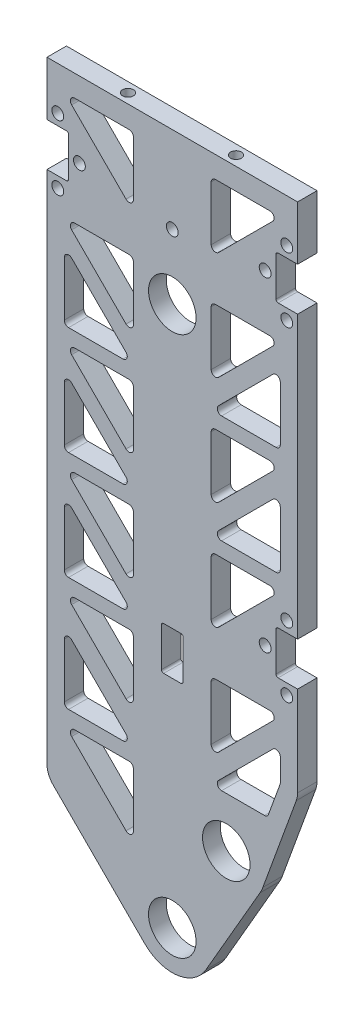
from build123d import *
from build123d.topology import SkipClean

# Parameters (mm, degrees)
SKETCH_1_R                   = 11
EXTRUDE_569_DEPTH            = 100
EXTRUDE_START                = -100
SKETCH_2_R                   = 11
EXTRUDE_878_DEPTH            = 100
EXTRUDE_2694_DEPTH           = 100
CUT_EXTRUDE_4151_DEPTH       = 534.010318849
CUT_EXTRUDE_4151_DEPTH_BACK  = 534.010318849
SKETCH_3_W                   = 90
SKETCH_3_H                   = 380
SKETCH_5_R                   = 2.5
EXTRUDE_4717_DEPTH           = 100
SKETCH_6_W                   = 191.177045066
SKETCH_6_H                   = 235.084722287
CUT_EXTRUDE_5031_DEPTH       = 84
SKETCH_7_R                   = 75
EXTRUDE_5319_DEPTH           = 5
CUT_EXTRUDE_6101_DEPTH       = 357.195171219
CUT_EXTRUDE_6101_DEPTH_BACK  = 357.195171219
FILLET_2_R                   = 2
MIRROR_START                 = 95
MIRROR_1_DEPTH               = 5
CUT_EXTRUDE_11154_DEPTH      = 357.195171219
CUT_EXTRUDE_11154_DEPTH_BACK = 357.195171219
SKETCH_12_W                  = 10
SKETCH_12_H                  = 20
FILLET_3_R                   = 1
CUT_EXTRUDE_START            = -5
CUT_EXTRUDE_12035_OUTLINE_R  = 5
CUT_EXTRUDE_12035_DEPTH      = 5
CUT_EXTRUDE_7_DEPTH          = 357.195171219
CUT_EXTRUDE_7_DEPTH_BACK     = 357.195171219
SKETCH_14_W                  = 10
SKETCH_14_H                  = 20
FILLET_4_R                   = 1
CUT_EXTRUDE_START_2          = -129
SKETCH_15_R                  = 11
CUT_EXTRUDE_8_DEPTH          = 129
SKETCH_16_R                  = 13
CUT_EXTRUDE_9_DEPTH          = 0.75
CUT_EXTRUDE_START_3          = -0.75
SKETCH_17_R                  = 13
CUT_EXTRUDE_10_DEPTH         = 0.75
SKETCH_18_R                  = 11
CUT_EXTRUDE_11_DEPTH         = 113
CUT_EXTRUDE_12_DEPTH         = 357.195171219
CUT_EXTRUDE_12_DEPTH_BACK    = 357.195171219
MOVE_FACE_1_BY               = 4
SKETCH_21_R                  = 2.5
CUT_EXTRUDE_13_DEPTH         = 22
SKETCH_22_R                  = 2.75
CUT_EXTRUDE_14_DEPTH         = 22
CUT_EXTRUDE_15_DEPTH         = 326.338285481
CUT_EXTRUDE_15_DEPTH_BACK    = 326.338285481
SKETCH_23_R                  = 2.75
SKETCH_24_R                  = 13
CUT_EXTRUDE_16_DEPTH         = 0.75
FILLET_5_R                   = 10


# Read off the part's stored shape, not the designer's step: 镜向1, 电机安装轴承孔
with BuildPart() as part:
    # 草图1 → Extrude 569 (new body)
    with BuildSketch(Plane.XY):
        with BuildLine():
            Line((-18, 500), (-18, 0))
            ThreePointArc((-18, 0), (0, -18), (18, 0))
            Line((18, 0), (18, 500))
            ThreePointArc((18, 500), (0, 518), (-18, 500))
        make_face()
        with Locations((0, 500)):
            Circle(SKETCH_1_R, mode=Mode.SUBTRACT)
        Circle(SKETCH_1_R, mode=Mode.SUBTRACT)
    extrude(amount=EXTRUDE_569_DEPTH)

    # 草图2 → Extrude 878 (add)
    with BuildSketch(Plane.XY.offset(100).offset(EXTRUDE_START)):
        with BuildLine():
            Line((18, 61.301270189), (25, 61.301270189))
            ThreePointArc((25, 61.301270189), (40.588457268, 52.301270189), (40.588457268, 34.301270189))
            Line((40.588457268, 34.301270189), (15.588457268, -9))
            ThreePointArc((15.588457268, -9), (-4.658742812, -17.386664873), (-18, 0))
            Line((-18, 0), (-18, 61.301270189))
            Line((-18, 61.301270189), (18, 61.301270189))
        make_face()
        with Locations((25, 43.301270189)):
            Circle(SKETCH_2_R, mode=Mode.SUBTRACT)
        Circle(SKETCH_2_R, mode=Mode.SUBTRACT)
    extrude(amount=EXTRUDE_878_DEPTH)

    # 草图10 → Extrude 2694 (add)
    with BuildSketch(Plane(origin=(0, 0, 0), x_dir=(-1, 0, 0), z_dir=(0, 0, -1))):
        with BuildLine():
            Line((-41.914467174, 37.144907609), (-58, 81.339545828))
            Line((-58, 81.339545828), (-58, 320))
            Line((-58, 320), (-18, 320))
            Line((-18, 320), (-18, 61.301270189))
            Line((-18, 61.301270189), (-25, 61.301270189))
            ThreePointArc((-25, 61.301270189), (-39.744736797, 53.625646044), (-41.914467174, 37.144907609))
        make_face()
        with BuildLine():
            Line((12.727922061, -12.727922061), (58, 32.544155877))
            Line((58, 32.544155877), (58, 320))
            Line((58, 320), (18, 320))
            Line((18, 320), (18, 0))
            ThreePointArc((18, 0), (16.629831585, -6.888301783), (12.727922061, -12.727922061))
        make_face()
    extrude(amount=-EXTRUDE_2694_DEPTH)

    # 草图3 → Cut-Extrude 4151 (cut, two sides: drawn at the far end of the back side and taken through both)
    with BuildSketch(Plane.ZY.offset(18).offset(-CUT_EXTRUDE_4151_DEPTH_BACK)):
        with Locations((50, 150)):
            Rectangle(SKETCH_3_W, SKETCH_3_H)
    extrude(amount=CUT_EXTRUDE_4151_DEPTH + CUT_EXTRUDE_4151_DEPTH_BACK, mode=Mode.SUBTRACT)

    # 草图5 → Extrude 4717 (add)
    with BuildSketch(Plane.XY.offset(100)):
        with Locations(Location((0, 250, 0), (0, 0, 90))):
            Circle(SKETCH_5_R)
    extrude(amount=-EXTRUDE_4717_DEPTH)

    # 草图6 → Cut-Extrude 5031 (cut)
    with BuildSketch(Plane(origin=(18, 0, 0), x_dir=(0, 0, -1), z_dir=(1, 0, 0))):
        with Locations((-50.962374235, 437.542361144)):
            Rectangle(SKETCH_6_W, SKETCH_6_H)
    extrude(amount=-CUT_EXTRUDE_5031_DEPTH, mode=Mode.SUBTRACT)

    # 草图7 → Extrude 5319 (add)
    with BuildSketch(Plane(origin=(0, 320, 0), x_dir=(1, 0, 0), z_dir=(0, 1, 0))):
        with Locations(Location((0, -50, 0), (0, 0, 320.654170234))):
            Circle(SKETCH_7_R)
    extrude(amount=EXTRUDE_5319_DEPTH)

    # 草图10<3> → Cut-Extrude 6101 (cut, two sides: drawn at the far end of the back side and taken through both)
    with BuildSketch(Plane(origin=(0, 0, 0), x_dir=(-1, 0, 0), z_dir=(0, 0, -1)).offset(-CUT_EXTRUDE_6101_DEPTH_BACK)):
        Polygon((50, 310), (18, 310), (18, 278), align=None)
        Polygon((-18, 278), (-18, 310), (-50, 310), align=None)
        Polygon((-18, 227.925713543), (-18, 259.925713543), (-50, 259.925713543), align=None)
        Polygon((50, 259.925713543), (18, 259.925713543), (18, 227.925713543), align=None)
        Polygon((50, 248.612005044), (50, 216.612005044), (18, 216.612005044), align=None)
        Polygon((-50, 248.612005044), (-50, 216.612005044), (-18, 216.612005044), align=None)
        Polygon((-18, 177.851427085), (-18, 209.851427085), (-50, 209.851427085), align=None)
        Polygon((50, 209.851427085), (18, 209.851427085), (18, 177.851427085), align=None)
        Polygon((50, 198.537718586), (50, 166.537718586), (18, 166.537718586), align=None)
        Polygon((-50, 198.537718586), (-50, 166.537718586), (-18, 166.537718586), align=None)
        Polygon((-50, 159.777140628), (-18, 127.777140628), (-18, 159.777140628), align=None)
        Polygon((18, 159.777140628), (18, 127.777140628), (50, 159.777140628), align=None)
        Polygon((-50, 109.702854171), (-18, 77.702854171), (-18, 109.702854171), align=None)
        Polygon((18, 109.702854171), (18, 77.702854171), (50, 109.702854171), align=None)
        Polygon((-50, 98.389145672), (-50, 82.750161674), (-44.045077173, 66.389145672), (-18, 66.389145672), align=None)
        Polygon((18, 56.800140588), (18, 24.800140588), (50, 56.800140588), align=None)
        Polygon((50, 95.560718547), (50, 63.560718547), (18, 63.560718547), align=None)
        Polygon((50, 116.463432129), (18, 116.463432129), (50, 148.463432129), align=None)
    extrude(amount=CUT_EXTRUDE_6101_DEPTH + CUT_EXTRUDE_6101_DEPTH_BACK, mode=Mode.SUBTRACT)

    # 圆角2
    fillet_2_edges = [part.edges().sort_by_distance(p)[0] for p in [
        (50, 109.702854171, 2.5),
        (18, 109.702854171, 2.5),
        (18, 77.702854171, 2.5),
        (-18, 159.777140628, 2.5),
        (-50, 159.777140628, 2.5),
        (-18, 127.777140628, 2.5),
        (50, 159.777140628, 2.5),
        (18, 159.777140628, 2.5),
        (18, 127.777140628, 2.5),
        (50, 166.537718586, 2.5),
        (50, 198.537718586, 2.5),
        (18, 166.537718586, 2.5),
        (-50, 63.560718547, 2.5),
        (-18, 63.560718547, 2.5),
        (-50, 95.560718547, 2.5),
        (-50, 56.800140588, 2.5),
        (-18, 24.800140588, 2.5),
        (-18, 56.800140588, 2.5),
        (50, 82.750161674, 2.5),
        (50, 98.389145672, 2.5),
        (18, 66.389145672, 2.5),
        (44.045077173, 66.389145672, 2.5),
        (-18, 109.702854171, 2.5),
        (-50, 109.702854171, 2.5),
        (-18, 77.702854171, 2.5),
        (50, 310, 2.5),
        (18, 310, 2.5),
        (18, 278, 2.5),
        (50, 259.925713543, 2.5),
        (18, 259.925713543, 2.5),
        (18, 227.925713543, 2.5),
        (-50, 248.612005044, 2.5),
        (-50, 216.612005044, 2.5),
        (-18, 216.612005044, 2.5),
        (-18, 259.925713543, 2.5),
        (-50, 259.925713543, 2.5),
        (-18, 227.925713543, 2.5),
        (50, 216.612005044, 2.5),
        (50, 248.612005044, 2.5),
        (18, 216.612005044, 2.5),
        (50, 209.851427085, 2.5),
        (18, 209.851427085, 2.5),
        (18, 177.851427085, 2.5),
        (-50, 198.537718586, 2.5),
        (-50, 166.537718586, 2.5),
        (-18, 166.537718586, 2.5),
        (-18, 209.851427085, 2.5),
        (-50, 209.851427085, 2.5),
        (-18, 177.851427085, 2.5),
        (-50, 148.463432129, 2.5),
        (-50, 116.463432129, 2.5),
        (-18, 116.463432129, 2.5),
        (-18, 310, 2.5),
        (-50, 310, 2.5),
        (-18, 278, 2.5),
    ]]
    fillet(fillet_2_edges, radius=FILLET_2_R)

    # 镜向1 outline → 镜向1 (add)
    with BuildSketch(Plane.XY.offset(MIRROR_START)):
        with BuildLine():
            ThreePointArc((-50, 143.635005004), (-48.765366865, 145.482764069), (-46.585786438, 145.049218567))
            Line((-46.585786438, 145.049218567), (-50, 148.463432129))
            Line((-50, 148.463432129), (-50, 143.635005004))
        make_face()
        with BuildLine():
            Line((-18, 116.463432129), (-21.414213562, 119.877645691))
            ThreePointArc((-21.414213562, 119.877645691), (-20.98066806, 117.698065264), (-22.828427125, 116.463432129))
            Line((-22.828427125, 116.463432129), (-18, 116.463432129))
        make_face()
        with BuildLine():
            ThreePointArc((-48, 116.463432129), (-49.414213562, 117.049218567), (-50, 118.463432129))
            Line((-50, 118.463432129), (-50, 116.463432129))
            Line((-50, 116.463432129), (-48, 116.463432129))
        make_face()
        with BuildLine():
            ThreePointArc((-20, 310), (-18.585786438, 309.414213562), (-18, 308))
            Line((-18, 308), (-18, 310))
            Line((-18, 310), (-20, 310))
        make_face()
        with BuildLine():
            Line((-18, 278), (-18, 282.828427125))
            ThreePointArc((-18, 282.828427125), (-19.234633135, 280.98066806), (-21.414213562, 281.414213562))
            Line((-21.414213562, 281.414213562), (-18, 278))
        make_face()
        with BuildLine():
            ThreePointArc((-46.585786438, 306.585786438), (-47.01933194, 308.765366865), (-45.171572875, 310))
            Line((-45.171572875, 310), (-50, 310))
            Line((-50, 310), (-46.585786438, 306.585786438))
        make_face()
        with BuildLine():
            ThreePointArc((-20, 259.925713543), (-18.585786438, 259.339927105), (-18, 257.925713543))
            Line((-18, 257.925713543), (-18, 259.925713543))
            Line((-18, 259.925713543), (-20, 259.925713543))
        make_face()
        with BuildLine():
            Line((-18, 227.925713543), (-18, 232.754140667))
            ThreePointArc((-18, 232.754140667), (-19.234633135, 230.906381602), (-21.414213562, 231.339927105))
            Line((-21.414213562, 231.339927105), (-18, 227.925713543))
        make_face()
        with BuildLine():
            ThreePointArc((-46.585786438, 256.51149998), (-47.01933194, 258.691080407), (-45.171572875, 259.925713543))
            Line((-45.171572875, 259.925713543), (-50, 259.925713543))
            Line((-50, 259.925713543), (-46.585786438, 256.51149998))
        make_face()
        with BuildLine():
            ThreePointArc((-50, 243.783577919), (-48.765366865, 245.631336984), (-46.585786438, 245.197791481))
            Line((-46.585786438, 245.197791481), (-50, 248.612005044))
            Line((-50, 248.612005044), (-50, 243.783577919))
        make_face()
        with BuildLine():
            Line((-18, 216.612005044), (-21.414213562, 220.026218606))
            ThreePointArc((-21.414213562, 220.026218606), (-20.98066806, 217.846638179), (-22.828427125, 216.612005044))
            Line((-22.828427125, 216.612005044), (-18, 216.612005044))
        make_face()
        with BuildLine():
            ThreePointArc((-48, 216.612005044), (-49.414213563, 217.197791481), (-50, 218.612005044))
            Line((-50, 218.612005044), (-50, 216.612005044))
            Line((-50, 216.612005044), (-48, 216.612005044))
        make_face()
        with BuildLine():
            ThreePointArc((-20, 209.851427085), (-18.585786438, 209.265640647), (-18, 207.851427085))
            Line((-18, 207.851427085), (-18, 209.851427085))
            Line((-18, 209.851427085), (-20, 209.851427085))
        make_face()
        with BuildLine():
            Line((-18, 177.851427085), (-18, 182.67985421))
            ThreePointArc((-18, 182.67985421), (-19.234633135, 180.832095145), (-21.414213562, 181.265640648))
            Line((-21.414213562, 181.265640648), (-18, 177.851427085))
        make_face()
        with BuildLine():
            ThreePointArc((-46.585786438, 206.437213523), (-47.01933194, 208.61679395), (-45.171572875, 209.851427085))
            Line((-45.171572875, 209.851427085), (-50, 209.851427085))
            Line((-50, 209.851427085), (-46.585786438, 206.437213523))
        make_face()
        with BuildLine():
            ThreePointArc((-50, 193.709291462), (-48.765366865, 195.557050527), (-46.585786438, 195.123505024))
            Line((-46.585786438, 195.123505024), (-50, 198.537718586))
            Line((-50, 198.537718586), (-50, 193.709291462))
        make_face()
        with BuildLine():
            Line((-18, 166.537718586), (-21.414213562, 169.951932149))
            ThreePointArc((-21.414213562, 169.951932149), (-20.98066806, 167.772351722), (-22.828427125, 166.537718586))
            Line((-22.828427125, 166.537718586), (-18, 166.537718586))
        make_face()
        with BuildLine():
            ThreePointArc((-48, 166.537718586), (-49.414213562, 167.123505024), (-50, 168.537718586))
            Line((-50, 168.537718586), (-50, 166.537718586))
            Line((-50, 166.537718586), (-48, 166.537718586))
        make_face()
        with BuildLine():
            ThreePointArc((-20, 159.777140628), (-18.585786438, 159.19135419), (-18, 157.777140628))
            Line((-18, 157.777140628), (-18, 159.777140628))
            Line((-18, 159.777140628), (-20, 159.777140628))
        make_face()
        with BuildLine():
            Line((-18, 127.777140628), (-18, 132.605567753))
            ThreePointArc((-18, 132.605567753), (-19.234633135, 130.757808688), (-21.414213562, 131.19135419))
            Line((-21.414213562, 131.19135419), (-18, 127.777140628))
        make_face()
        with BuildLine():
            ThreePointArc((-46.585786438, 156.362927066), (-47.01933194, 158.542507493), (-45.171572875, 159.777140628))
            Line((-45.171572875, 159.777140628), (-50, 159.777140628))
            Line((-50, 159.777140628), (-46.585786438, 156.362927066))
        make_face()
        with BuildLine():
            ThreePointArc((-20, 109.702854171), (-18.585786438, 109.117067733), (-18, 107.702854171))
            Line((-18, 107.702854171), (-18, 109.702854171))
            Line((-18, 109.702854171), (-20, 109.702854171))
        make_face()
        with BuildLine():
            Line((-18, 77.702854171), (-18, 82.531281295))
            ThreePointArc((-18, 82.531281295), (-19.234633135, 80.68352223), (-21.414213562, 81.117067733))
            Line((-21.414213562, 81.117067733), (-18, 77.702854171))
        make_face()
        with BuildLine():
            ThreePointArc((-46.585786438, 106.288640608), (-47.01933194, 108.468221035), (-45.171572875, 109.702854171))
            Line((-45.171572875, 109.702854171), (-50, 109.702854171))
            Line((-50, 109.702854171), (-46.585786438, 106.288640608))
        make_face()
        with BuildLine():
            ThreePointArc((-50, 90.732291422), (-48.765366865, 92.580050487), (-46.585786438, 92.146504984))
            Line((-46.585786438, 92.146504984), (-50, 95.560718547))
            Line((-50, 95.560718547), (-50, 90.732291422))
        make_face()
        with BuildLine():
            Line((-18, 63.560718547), (-21.414213562, 66.974932109))
            ThreePointArc((-21.414213562, 66.974932109), (-20.98066806, 64.795351682), (-22.828427125, 63.560718547))
            Line((-22.828427125, 63.560718547), (-18, 63.560718547))
        make_face()
        with BuildLine():
            ThreePointArc((-48, 63.560718547), (-49.414213562, 64.146504984), (-50, 65.560718547))
            Line((-50, 65.560718547), (-50, 63.560718547))
            Line((-50, 63.560718547), (-48, 63.560718547))
        make_face()
        with BuildLine():
            ThreePointArc((-46.585786438, 53.385927026), (-47.01933194, 55.565507453), (-45.171572875, 56.800140588))
            Line((-45.171572875, 56.800140588), (-50, 56.800140588))
            Line((-50, 56.800140588), (-46.585786438, 53.385927026))
        make_face()
        with BuildLine():
            Line((-18, 56.800140588), (-20, 56.800140588))
            ThreePointArc((-20, 56.800140588), (-18.585786437, 56.214354151), (-18, 54.800140588))
            Line((-18, 54.800140588), (-18, 56.800140588))
        make_face()
        with BuildLine():
            ThreePointArc((-18, 29.628567713), (-19.234633135, 27.780808648), (-21.414213562, 28.214354151))
            Line((-21.414213562, 28.214354151), (-18, 24.800140588))
            Line((-18, 24.800140588), (-18, 29.628567713))
        make_face()
        with BuildLine():
            ThreePointArc((46.585786438, 94.974932109), (48.765366865, 95.408477612), (50, 93.560718547))
            Line((50, 93.560718547), (50, 98.389145672))
            Line((50, 98.389145672), (46.585786438, 94.974932109))
        make_face()
        with BuildLine():
            Line((50, 82.750161674), (50, 83.102815635))
            ThreePointArc((50, 83.102815635), (49.969615506, 82.75551928), (49.879385242, 82.418775349))
            Line((49.879385242, 82.418775349), (50, 82.750161674))
        make_face()
        with BuildLine():
            ThreePointArc((22.828427125, 66.389145672), (20.98066806, 67.623778807), (21.414213562, 69.803359234))
            Line((21.414213562, 69.803359234), (18, 66.389145672))
            Line((18, 66.389145672), (22.828427125, 66.389145672))
        make_face()
        with BuildLine():
            Line((44.045077173, 66.389145672), (44.524047338, 67.705105385))
            ThreePointArc((44.524047338, 67.705105385), (43.791814969, 66.750841583), (42.644662096, 66.389145672))
            Line((42.644662096, 66.389145672), (44.045077173, 66.389145672))
        make_face()
        with BuildLine():
            Line((18, 109.702854171), (18, 107.702854171))
            ThreePointArc((18, 107.702854171), (18.585786438, 109.117067733), (20, 109.702854171))
            Line((20, 109.702854171), (18, 109.702854171))
        make_face()
        with BuildLine():
            ThreePointArc((21.414213562, 81.117067733), (19.234633135, 80.68352223), (18, 82.531281295))
            Line((18, 82.531281295), (18, 77.702854171))
            Line((18, 77.702854171), (21.414213562, 81.117067733))
        make_face()
        with BuildLine():
            Line((50, 109.702854171), (45.171572875, 109.702854171))
            ThreePointArc((45.171572875, 109.702854171), (47.01933194, 108.468221035), (46.585786438, 106.288640608))
            Line((46.585786438, 106.288640608), (50, 109.702854171))
        make_face()
        with BuildLine():
            Line((18, 159.777140628), (18, 157.777140628))
            ThreePointArc((18, 157.777140628), (18.585786438, 159.19135419), (20, 159.777140628))
            Line((20, 159.777140628), (18, 159.777140628))
        make_face()
        with BuildLine():
            ThreePointArc((21.414213562, 131.19135419), (19.234633135, 130.757808688), (18, 132.605567753))
            Line((18, 132.605567753), (18, 127.777140628))
            Line((18, 127.777140628), (21.414213562, 131.19135419))
        make_face()
        with BuildLine():
            Line((50, 159.777140628), (45.171572875, 159.777140628))
            ThreePointArc((45.171572875, 159.777140628), (47.01933194, 158.542507493), (46.585786438, 156.362927066))
            Line((46.585786438, 156.362927066), (50, 159.777140628))
        make_face()
        with BuildLine():
            ThreePointArc((50, 168.537718586), (49.414213562, 167.123505024), (48, 166.537718586))
            Line((48, 166.537718586), (50, 166.537718586))
            Line((50, 166.537718586), (50, 168.537718586))
        make_face()
        with BuildLine():
            Line((18, 166.537718586), (22.828427125, 166.537718586))
            ThreePointArc((22.828427125, 166.537718586), (20.98066806, 167.772351722), (21.414213562, 169.951932149))
            Line((21.414213562, 169.951932149), (18, 166.537718586))
        make_face()
        with BuildLine():
            ThreePointArc((46.585786438, 195.123505024), (48.765366865, 195.557050527), (50, 193.709291462))
            Line((50, 193.709291462), (50, 198.537718586))
            Line((50, 198.537718586), (46.585786438, 195.123505024))
        make_face()
        with BuildLine():
            Line((18, 177.851427085), (21.414213562, 181.265640648))
            ThreePointArc((21.414213562, 181.265640648), (19.234633135, 180.832095145), (18, 182.67985421))
            Line((18, 182.67985421), (18, 177.851427085))
        make_face()
        with BuildLine():
            ThreePointArc((45.171572875, 209.851427085), (47.01933194, 208.61679395), (46.585786438, 206.437213523))
            Line((46.585786438, 206.437213523), (50, 209.851427085))
            Line((50, 209.851427085), (45.171572875, 209.851427085))
        make_face()
        with BuildLine():
            Line((18, 209.851427085), (18, 207.851427085))
            ThreePointArc((18, 207.851427085), (18.585786438, 209.265640647), (20, 209.851427085))
            Line((20, 209.851427085), (18, 209.851427085))
        make_face()
        with BuildLine():
            ThreePointArc((50, 218.612005044), (49.414213563, 217.197791481), (48, 216.612005044))
            Line((48, 216.612005044), (50, 216.612005044))
            Line((50, 216.612005044), (50, 218.612005044))
        make_face()
        with BuildLine():
            Line((18, 216.612005044), (22.828427125, 216.612005044))
            ThreePointArc((22.828427125, 216.612005044), (20.98066806, 217.846638179), (21.414213562, 220.026218606))
            Line((21.414213562, 220.026218606), (18, 216.612005044))
        make_face()
        with BuildLine():
            ThreePointArc((46.585786438, 245.197791481), (48.765366865, 245.631336984), (50, 243.783577919))
            Line((50, 243.783577919), (50, 248.612005044))
            Line((50, 248.612005044), (46.585786438, 245.197791481))
        make_face()
        with BuildLine():
            Line((18, 227.925713543), (21.414213562, 231.339927105))
            ThreePointArc((21.414213562, 231.339927105), (19.234633135, 230.906381602), (18, 232.754140667))
            Line((18, 232.754140667), (18, 227.925713543))
        make_face()
        with BuildLine():
            ThreePointArc((45.171572875, 259.925713543), (47.01933194, 258.691080407), (46.585786438, 256.51149998))
            Line((46.585786438, 256.51149998), (50, 259.925713543))
            Line((50, 259.925713543), (45.171572875, 259.925713543))
        make_face()
        with BuildLine():
            Line((18, 259.925713543), (18, 257.925713543))
            ThreePointArc((18, 257.925713543), (18.585786438, 259.339927105), (20, 259.925713543))
            Line((20, 259.925713543), (18, 259.925713543))
        make_face()
        with BuildLine():
            Line((18, 278), (21.414213562, 281.414213562))
            ThreePointArc((21.414213562, 281.414213562), (19.234633135, 280.98066806), (18, 282.828427125))
            Line((18, 282.828427125), (18, 278))
        make_face()
        with BuildLine():
            ThreePointArc((45.171572875, 310), (47.01933194, 308.765366865), (46.585786438, 306.585786438))
            Line((46.585786438, 306.585786438), (50, 310))
            Line((50, 310), (45.171572875, 310))
        make_face()
        with BuildLine():
            Line((18, 310), (18, 308))
            ThreePointArc((18, 308), (18.585786438, 309.414213562), (20, 310))
            Line((20, 310), (18, 310))
        make_face()
    extrude(amount=MIRROR_1_DEPTH)

    # 草图12 → Cut-Extrude 11154 (cut, two sides: drawn at the far end of the back side and taken through both)
    with BuildSketch(Plane(origin=(0, 0, 0), x_dir=(-1, 0, 0), z_dir=(0, 0, -1)).offset(-CUT_EXTRUDE_11154_DEPTH_BACK)):
        with Locations((-53, 285)):
            Rectangle(SKETCH_12_W, SKETCH_12_H)
        with Locations((-53, 134.702854171)):
            Rectangle(SKETCH_12_W, SKETCH_12_H)
        with Locations((53, 285)):
            Rectangle(SKETCH_12_W, SKETCH_12_H)
    extrude(amount=CUT_EXTRUDE_11154_DEPTH + CUT_EXTRUDE_11154_DEPTH_BACK, mode=Mode.SUBTRACT)

    # 圆角3
    fillet_3_edges = [part.edges().sort_by_distance(p)[0] for p in [
        (-48, 275, 2.5),
        (-48, 295, 2.5),
        (-48, 275, 97.5),
        (-48, 295, 97.5),
        (48, 144.702854171, 2.5),
        (48, 124.702854171, 2.5),
        (48, 144.702854171, 97.5),
        (48, 124.702854171, 97.5),
        (48, 295, 2.5),
        (48, 275, 2.5),
        (48, 295, 97.5),
        (48, 275, 97.5),
    ]]
    fillet(fillet_3_edges, radius=FILLET_3_R)

    # Cut-Extrude 12035 outline → Cut-Extrude 12035 (cut)
    with BuildSketch(Plane.XY.offset(5).offset(CUT_EXTRUDE_START)):
        with Locations((0, 250)):
            Circle(CUT_EXTRUDE_12035_OUTLINE_R)
    cut_extrude_12035 = extrude(amount=CUT_EXTRUDE_12035_DEPTH, mode=Mode.SUBTRACT)

    # 镜向2: Cut-Extrude 12035 across plane
    add(cut_extrude_12035.mirror(Plane(origin=(0, 0, 50), x_dir=(1, 0, 0), z_dir=(0, 0, -1))), mode=Mode.SUBTRACT)

    # 草图14 → 切除-拉伸7 (cut, two sides: drawn at the far end of the back side and taken through both)
    with BuildSketch(Plane(origin=(0, 0, 0), x_dir=(-1, 0, 0), z_dir=(0, 0, -1)).offset(-CUT_EXTRUDE_7_DEPTH_BACK)):
        with Locations((0, 110)):
            Rectangle(SKETCH_14_W, SKETCH_14_H)
    extrude(amount=CUT_EXTRUDE_7_DEPTH + CUT_EXTRUDE_7_DEPTH_BACK, mode=Mode.SUBTRACT)

    # 圆角4
    fillet_4_edges = [part.edges().sort_by_distance(p)[0] for p in [
        (5, 100, 2.5),
        (5, 120, 2.5),
        (-5, 120, 2.5),
        (-5, 100, 2.5),
        (5, 100, 97.5),
        (5, 120, 97.5),
        (-5, 120, 97.5),
        (-5, 100, 97.5),
    ]]
    fillet(fillet_4_edges, radius=FILLET_4_R)

    # 草图15 → 切除-拉伸8 (cut)
    with BuildSketch(Plane.XY.offset(100).offset(CUT_EXTRUDE_START_2)):
        with Locations((25, 43.301270189)):
            Circle(SKETCH_15_R)
    extrude(amount=CUT_EXTRUDE_8_DEPTH, mode=Mode.SUBTRACT)

    # 草图16 → 切除-拉伸9 (cut)
    with BuildSketch(Plane.XY.offset(100)):
        with Locations((25, 43.301270189)):
            Circle(SKETCH_16_R)
        Circle(SKETCH_16_R)
    extrude(amount=-CUT_EXTRUDE_9_DEPTH, mode=Mode.SUBTRACT)

    # 草图17 → 切除-拉伸10 (cut)
    with BuildSketch(Plane(origin=(0, 0, 0), x_dir=(-1, 0, 0), z_dir=(0, 0, -1)).offset(CUT_EXTRUDE_START_3)):
        with Locations(Location((0, 0, 0), (0, 0, 180))):
            Circle(SKETCH_17_R)
        with Locations(Location((-25, 43.301270189, 0), (0, 0, 180))):
            Circle(SKETCH_17_R)
    extrude(amount=CUT_EXTRUDE_10_DEPTH, mode=Mode.SUBTRACT)

    # 草图18 → 切除-拉伸11 (cut)
    with BuildSketch(Plane.XY.offset(100)):
        with Locations((0, 250)):
            Circle(SKETCH_18_R)
    extrude(amount=-CUT_EXTRUDE_11_DEPTH, mode=Mode.SUBTRACT)

    # 草图20 → 切除-拉伸12 (cut, two sides: drawn at the far end of the back side and taken through both)
    with BuildSketch(Plane(origin=(0, 0, 0), x_dir=(0, 0, -1), z_dir=(1, 0, 0)).offset(-CUT_EXTRUDE_12_DEPTH_BACK)):
        Polygon((0, 320), (25, 320), (25, 325), (-125, 325), (-125, -65.067335994), (-50, -65.067335994), (-50, 320), align=None)
    extrude(amount=CUT_EXTRUDE_12_DEPTH + CUT_EXTRUDE_12_DEPTH_BACK, mode=Mode.SUBTRACT)

    # Move Face 1: a face moved outward by 4.0
    extrude(part.faces().sort_by_distance((-0.855426636, 163.028428235, 5))[0], amount=MOVE_FACE_1_BY, dir=(0, 0, 1))

    # 草图21 → 切除-拉伸13 (cut)
    with SkipClean():  # the faces are left unmerged after this step: merging them gives an invalid solid
        with BuildSketch(Plane(origin=(0, 320, 0), x_dir=(1, 0, 0), z_dir=(0, 1, 0))):
            with Locations(Location((25, -4.5, 0), (0, 0, 270))):
                Circle(SKETCH_21_R)
            with Locations(Location((-25, -4.5, 0), (0, 0, 270))):
                Circle(SKETCH_21_R)
        extrude(amount=-CUT_EXTRUDE_13_DEPTH, mode=Mode.SUBTRACT)

    # 草图22 → 切除-拉伸14 (cut)
    with SkipClean():  # the faces are left unmerged after this step: merging them gives an invalid solid
        with BuildSketch(Plane(origin=(0, 0, 0), x_dir=(-1, 0, 0), z_dir=(0, 0, -1))):
            with Locations((0, 280)):
                Circle(SKETCH_22_R)
        extrude(amount=-CUT_EXTRUDE_14_DEPTH, mode=Mode.SUBTRACT)

    # 草图23 → 切除-拉伸15 (cut, two sides: drawn at the far end of the back side and taken through both)
    with SkipClean():  # the faces are left unmerged after this step: merging them gives an invalid solid
        with BuildSketch(Plane(origin=(0, 0, 0), x_dir=(-1, 0, 0), z_dir=(0, 0, -1)).offset(-CUT_EXTRUDE_15_DEPTH_BACK)):
            with Locations((53, 300)):
                Circle(SKETCH_23_R)
            with Locations((43, 285)):
                Circle(SKETCH_23_R)
            with Locations((53, 270)):
                Circle(SKETCH_23_R)
            with Locations((-53, 300)):
                Circle(SKETCH_23_R)
            with Locations((-43, 285)):
                Circle(SKETCH_23_R)
            with Locations((-53, 270)):
                Circle(SKETCH_23_R)
            with Locations((-53, 149.702854171)):
                Circle(SKETCH_23_R)
            with Locations((-43, 134.702854171)):
                Circle(SKETCH_23_R)
            with Locations((-53, 119.702854171)):
                Circle(SKETCH_23_R)
        extrude(amount=CUT_EXTRUDE_15_DEPTH + CUT_EXTRUDE_15_DEPTH_BACK, mode=Mode.SUBTRACT)

    # 草图24 → 切除-拉伸16 (cut)
    with SkipClean():  # the faces are left unmerged after this step: merging them gives an invalid solid
        with BuildSketch(Plane(origin=(0, 0, 0), x_dir=(-1, 0, 0), z_dir=(0, 0, -1))):
            with Locations((0, 250)):
                Circle(SKETCH_24_R)
        extrude(amount=-CUT_EXTRUDE_16_DEPTH, mode=Mode.SUBTRACT)

    # 圆角5
    fillet_5_edges = [part.edges().sort_by_distance(p)[0] for p in [
        (-58, 32.544155877, 4.5),
        (58, 81.339545828, 2.5),
    ]]
    fillet(fillet_5_edges, radius=FILLET_5_R)


solid = part.part
